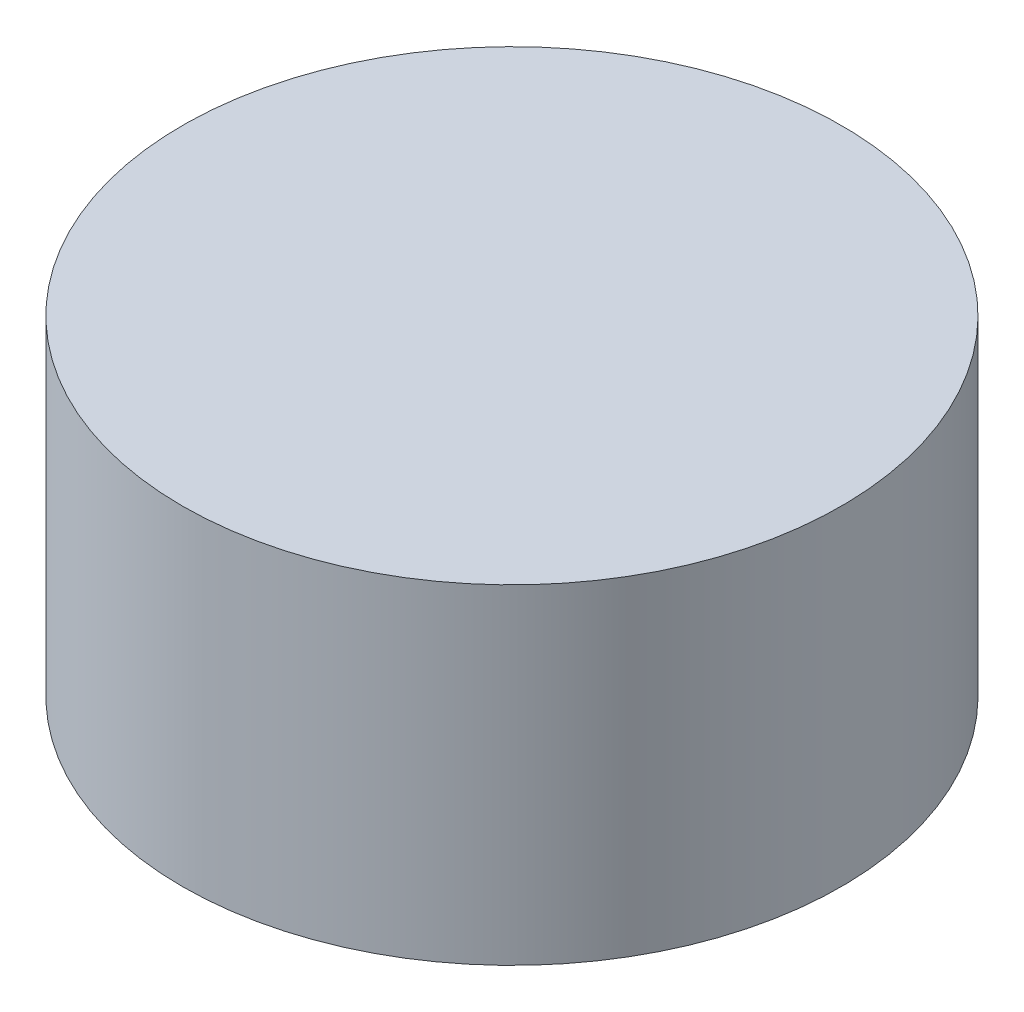
from build123d import *

# Parameters (mm, degrees)
SKETCH1_R           = 6.35
BOSS_EXTRUDE1_DEPTH = 6.35


with BuildPart() as part:
    # Sketch1 → Boss-Extrude1 (new body)
    with BuildSketch(Plane(origin=(0, 0, 0), x_dir=(1, 0, 0), z_dir=(0, 1, 0))):
        Circle(SKETCH1_R)
    extrude(amount=BOSS_EXTRUDE1_DEPTH)


solid = part.part
